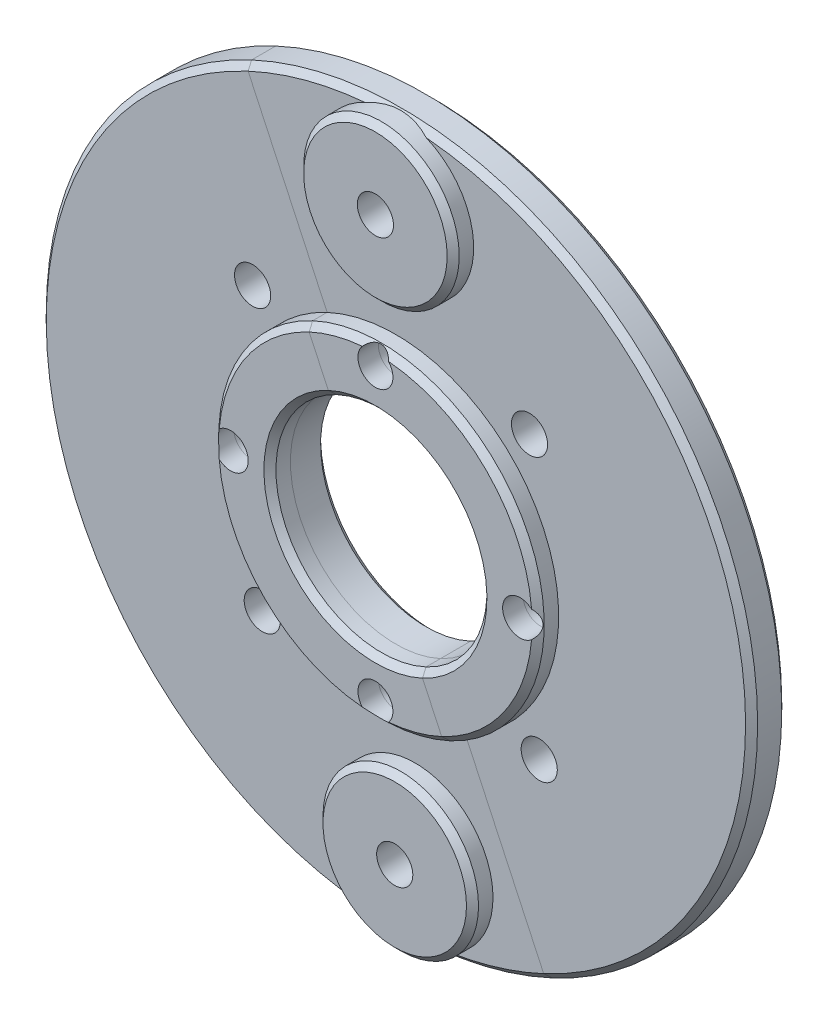
from build123d import *

# Parameters (mm, degrees)
SKETCH1_R                = 27
SKETCH1_R_2              = 17.5
BOSS_EXTRUDE1_DEPTH      = 3.4
SKETCH3_R                = 59
SKETCH3_R_2              = 17.5
BOSS_EXTRUDE2_DEPTH      = 6
CUT_EXTRUDE1_DEPTH       = 84.654049513
CUT_EXTRUDE1_DEPTH_BACK  = 84.654049513
SKETCH2_R                = 2.9
SKETCH2_R_2              = 3
SKETCH4_R                = 12.9
SKETCH4_R_2              = 3
BOSS_EXTRUDE3_DEPTH      = 3.4
CUT_EXTRUDE2_DEPTH       = 84.654049513
CUT_EXTRUDE2_DEPTH_BACK  = 84.654049513
SKETCH4_2_R              = 3
CHAMFER1_SIZE            = 1
CHAMFER2_SIZE            = 1
INTERSECT1_OUTLINE_W     = 122
INTERSECT1_OUTLINE_H     = 9.4
INTERSECT1_DEPTH         = 60
INTERSECT1_START         = -6
INTERSECT1_2_OUTLINE_R   = 3
INTERSECT1_2_OUTLINE_R_2 = 2.9
INTERSECT1_2_DEPTH       = 6
INTERSECT1_3_OUTLINE_R   = 12.9
INTERSECT1_3_OUTLINE_R_2 = 3
INTERSECT1_3_DEPTH       = 3.4
INTERSECT1_6_OUTLINE_W   = 0.8
INTERSECT1_6_OUTLINE_H   = 0.800254312
INTERSECT1_7_OUTLINE_R   = 2.9
INTERSECT1_7_DEPTH       = 3.4
INTERSECT1_9_OUTLINE_W   = 56
INTERSECT1_9_OUTLINE_H   = 3.4
INTERSECT1_9_DEPTH       = 28


with BuildPart() as part:
    # Sketch1 → Boss-Extrude1 (new body)
    with BuildSketch(Plane.XY):
        Circle(SKETCH1_R)
        Circle(SKETCH1_R_2, mode=Mode.SUBTRACT)
    extrude(amount=BOSS_EXTRUDE1_DEPTH)


with BuildPart() as body_2:
    # Sketch3 → Boss-Extrude2 (new body)
    with BuildSketch(Plane.XY):
        Circle(SKETCH3_R)
        Circle(SKETCH3_R_2, mode=Mode.SUBTRACT)
    extrude(amount=-BOSS_EXTRUDE2_DEPTH)


with BuildPart() as cut_extrude1_tool:
    # Sketch2 → Cut-Extrude1 (new, two sides: drawn at the far end of the back side and taken through both)
    with BuildSketch(Plane.XY.offset(-CUT_EXTRUDE1_DEPTH_BACK)):
        with Locations((0, 24)):
            Circle(SKETCH2_R)
        with Locations((24, 0)):
            Circle(SKETCH2_R)
        with Locations((0, -24)):
            Circle(SKETCH2_R)
        with Locations((-24, 0)):
            Circle(SKETCH2_R)
        with Locations((-23.768995303, 22.164946702)):
            Circle(SKETCH2_R_2)
        with Locations((22.164946702, 23.768995303)):
            Circle(SKETCH2_R_2)
        with Locations((23.768995303, -22.164946702)):
            Circle(SKETCH2_R_2)
        with Locations((-22.164946702, -23.768995303)):
            Circle(SKETCH2_R_2)
    extrude(amount=CUT_EXTRUDE1_DEPTH + CUT_EXTRUDE1_DEPTH_BACK)


with BuildPart() as part_1:
    add(part.part)

    # Cut-Extrude1: cut by cut_extrude1_tool
    add(cut_extrude1_tool.part, mode=Mode.SUBTRACT)

    # Chamfer2
    # the kernel refuses this chamfer: 1 mm, written as the material it takes off along each edge
    with BuildSketch(Plane(origin=(0, 0, 3.4), x_dir=(1, 0, 0), z_dir=(0, -1, 0))) as chamfer2_piece_1:
        Polygon((27, -CHAMFER2_SIZE), (27 - CHAMFER2_SIZE, 0), (27, 0), align=None)
    revolve(axis=Axis((0, 0, 3.4), (0, 0, 1)), mode=Mode.SUBTRACT)
    with BuildSketch(Plane(origin=(0, 0, 3.4), x_dir=(1, 0, 0), z_dir=(0, -1, 0))) as chamfer2_piece_2:
        Polygon((17.5 + CHAMFER2_SIZE, 0), (17.5, -CHAMFER2_SIZE), (17.5, 0), align=None)
    revolve(axis=Axis((0, 0, 3.4), (0, 0, 1)), mode=Mode.SUBTRACT)

    # Intersect1 9 outline → Intersect1 9 (cut)
    with BuildSketch(Plane(origin=(0, 0, 0), x_dir=(-0.4226182617406999, 0.9063077870366498, 0), z_dir=(0.9063077870366498, 0.4226182617406999, 0))):
        with Locations((0, 1.7)):
            Rectangle(INTERSECT1_9_OUTLINE_W, INTERSECT1_9_OUTLINE_H)
    extrude(amount=INTERSECT1_9_DEPTH, mode=Mode.SUBTRACT)


with BuildPart() as body_2_1:
    add(body_2.part)

    # Cut-Extrude1: cut by cut_extrude1_tool
    add(cut_extrude1_tool.part, mode=Mode.SUBTRACT)

    # Sketch4 → Boss-Extrude3 (add)
    # profile 1 of 2: a face of its own
    with BuildSketch(Plane.XY):
        with Locations((0, 45.9)):
            Circle(SKETCH4_R)
        with Locations((0, 45.9)):
            Circle(SKETCH4_R_2, mode=Mode.SUBTRACT)
    # profile 2 of 2: a face of its own
    with BuildSketch(Plane.XY):
        with Locations((3.203773797, -45.84407792)):
            Circle(SKETCH4_R)
        with Locations((3.203773797, -45.84407792)):
            Circle(SKETCH4_R_2, mode=Mode.SUBTRACT)
    extrude(amount=BOSS_EXTRUDE3_DEPTH)

    # Sketch4<2> → Cut-Extrude2 (cut, two sides: drawn at the far end of the back side and taken through both)
    with BuildSketch(Plane.XY.offset(-CUT_EXTRUDE2_DEPTH_BACK)):
        with Locations((0, 45.9)):
            Circle(SKETCH4_2_R)
        with Locations((3.203773797, -45.84407792)):
            Circle(SKETCH4_2_R)
    extrude(amount=CUT_EXTRUDE2_DEPTH + CUT_EXTRUDE2_DEPTH_BACK, mode=Mode.SUBTRACT)

    # Chamfer1
    # the kernel refuses this chamfer: 1 mm, written as the material it takes off along each edge
    with BuildSketch(Plane(origin=(0, 0, 0), x_dir=(1, 0, 0), z_dir=(0, -1, 0))) as chamfer1_piece_1_section:
        Polygon((59, -CHAMFER1_SIZE), (59 - CHAMFER1_SIZE, 0), (59, 0), align=None)
    chamfer1_piece_1 = revolve(axis=Axis((0, 0, 0), (0, 0, 1)), mode=Mode.PRIVATE)
    chamfer1_piece_1 = chamfer1_piece_1 - Plane(origin=(3.203773797, -45.84407792, 0), x_dir=(1, 0, 0), z_dir=(0, 0, -1)) * Cylinder(12.9, 237, mode=Mode.PRIVATE)
    chamfer1_piece_1 = chamfer1_piece_1 - Plane(origin=(0, 45.9, 0), x_dir=(1, 0, 0), z_dir=(0, 0, -1)) * Cylinder(12.9, 237, mode=Mode.PRIVATE)
    add(chamfer1_piece_1, mode=Mode.SUBTRACT)
    with BuildSketch(Plane(origin=(0, 0, -6), x_dir=(1, 0, 0), z_dir=(0, -1, 0))) as chamfer1_piece_2:
        Polygon((59, CHAMFER1_SIZE), (59 - CHAMFER1_SIZE, 0), (59, 0), align=None)
    revolve(axis=Axis((0, 0, -6), (0, 0, 1)), mode=Mode.SUBTRACT)
    with BuildSketch(Plane(origin=(0, 0, -6), x_dir=(1, 0, 0), z_dir=(0, -1, 0))) as chamfer1_piece_3:
        Polygon((17.5 + CHAMFER1_SIZE, 0), (17.5, CHAMFER1_SIZE), (17.5, 0), align=None)
    revolve(axis=Axis((0, 0, -6), (0, 0, 1)), mode=Mode.SUBTRACT)
    with BuildSketch(Plane(origin=(0, 45.9, 3.4), x_dir=(1, 0, 0), z_dir=(0, -1, 0))) as chamfer1_piece_4:
        Polygon((12.9, -CHAMFER1_SIZE), (12.9 - CHAMFER1_SIZE, 0), (12.9, 0), align=None)
    revolve(axis=Axis((0, 45.9, 3.4), (0, 0, 1)), mode=Mode.SUBTRACT)
    with BuildSketch(Plane(origin=(3.203773797, -45.84407792, 3.4), x_dir=(1, 0, 0), z_dir=(0, -1, 0))) as chamfer1_piece_5:
        Polygon((12.9, -CHAMFER1_SIZE), (12.9 - CHAMFER1_SIZE, 0), (12.9, 0), align=None)
    revolve(axis=Axis((3.203773797, -45.84407792, 3.4), (0, 0, 1)), mode=Mode.SUBTRACT)

    # Intersect1: read off the stored shape, not the designer's step
    # Intersect1 outline → Intersect1 (cut)
    with BuildSketch(Plane(origin=(0, 0, 0), x_dir=(-0.4226182617406999, 0.9063077870366498, 0), z_dir=(0.9063077870366498, 0.4226182617406999, 0))):
        with Locations((0, -1.3)):
            Rectangle(INTERSECT1_OUTLINE_W, INTERSECT1_OUTLINE_H)
    extrude(amount=INTERSECT1_DEPTH, mode=Mode.SUBTRACT)


with BuildPart() as body_3:
    # Intersect1 2 outline → Intersect1 2 (new body)
    with BuildSketch(Plane.XY.offset(INTERSECT1_START)):
        with BuildLine():
            Line((7.39581958, -15.860386273), (24.934477443, -53.472159435))
            ThreePointArc((24.934477443, -53.472159435), (53.472159435, 24.934477443), (-24.934477443, 53.472159435))
            Line((-24.934477443, 53.472159435), (-7.39581958, 15.860386273))
            ThreePointArc((-7.39581958, 15.860386273), (15.860386273, 7.39581958), (7.39581958, -15.860386273))
        make_face()
        with Locations((23.768995303, -22.164946702)):
            Circle(INTERSECT1_2_OUTLINE_R, mode=Mode.SUBTRACT)
        with Locations((24, 0)):
            Circle(INTERSECT1_2_OUTLINE_R_2, mode=Mode.SUBTRACT)
        with Locations((0, 24)):
            Circle(INTERSECT1_2_OUTLINE_R_2, mode=Mode.SUBTRACT)
        with Locations((22.164946702, 23.768995303)):
            Circle(INTERSECT1_2_OUTLINE_R, mode=Mode.SUBTRACT)
        with Locations((0, 45.9)):
            Circle(INTERSECT1_2_OUTLINE_R, mode=Mode.SUBTRACT)
    extrude(amount=INTERSECT1_2_DEPTH)

    # Intersect1 3 outline → Intersect1 3 (add)
    with BuildSketch(Plane.XY):
        with Locations((0, 45.9)):
            Circle(INTERSECT1_3_OUTLINE_R)
        with Locations((0, 45.9)):
            Circle(INTERSECT1_3_OUTLINE_R_2, mode=Mode.SUBTRACT)
    extrude(amount=INTERSECT1_3_DEPTH)

    # Intersect1 4 outline → Intersect1 4 (revolve, cut)
    with BuildSketch(Plane.XZ):
        Polygon((59, 0), (58, 0), (59, -1), align=None)
        Polygon((59, -6), (59, -5), (58, -6), align=None)
        Polygon((17.5, -6), (18.5, -6), (17.5, -5), align=None)
    revolve(axis=Axis((0, 0, 0), (0, 0, 1)), mode=Mode.SUBTRACT)

    # Intersect1 5 outline → Intersect1 5 (revolve, cut)
    with BuildSketch(Plane.XZ.offset(-45.9)):
        Polygon((11.9, 3.4), (12.9, 2.4), (12.9, 3.4), align=None)
    revolve(axis=Axis((0, 45.9, 0), (0, 0, 1)), mode=Mode.SUBTRACT)

    # Intersect1 6 outline → Intersect1 6 (revolve)
    with BuildSketch(Plane.XZ.offset(-45.9)):
        with Locations((12.5, -0.400127156)):
            Rectangle(INTERSECT1_6_OUTLINE_W, INTERSECT1_6_OUTLINE_H)
    revolve(axis=Axis((0, 45.9, 0), (0, 0, 1)))


with BuildPart() as body_4:
    # Intersect1 7 outline → Intersect1 7 (new body)
    with BuildSketch(Plane.XY):
        with BuildLine():
            Line((7.39581958, -15.860386273), (11.410693067, -24.47031025))
            ThreePointArc((11.410693067, -24.47031025), (24.47031025, 11.410693067), (-11.410693067, 24.47031025))
            Line((-11.410693067, 24.47031025), (-7.39581958, 15.860386273))
            ThreePointArc((-7.39581958, 15.860386273), (15.860386273, 7.39581958), (7.39581958, -15.860386273))
        make_face()
        with Locations((24, 0)):
            Circle(INTERSECT1_7_OUTLINE_R, mode=Mode.SUBTRACT)
        with Locations((0, 24)):
            Circle(INTERSECT1_7_OUTLINE_R, mode=Mode.SUBTRACT)
    extrude(amount=INTERSECT1_7_DEPTH)

    # Intersect1 8 outline → Intersect1 8 (revolve, cut)
    with BuildSketch(Plane.XZ):
        Polygon((27, 3.4), (26, 3.4), (27, 2.4), align=None)
        Polygon((17.5, 2.4), (18.5, 3.4), (17.5, 3.4), align=None)
    revolve(axis=Axis((0, 0, 0), (0, 0, 1)), mode=Mode.SUBTRACT)


solid = Compound([part_1.part, body_2_1.part, body_3.part, body_4.part])
